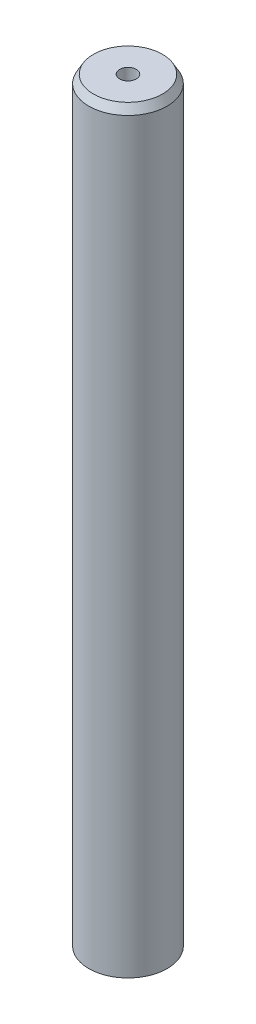
from build123d import *
from OCP.BRepFilletAPI import BRepFilletAPI_MakeChamfer

# Parameters (mm, degrees)
SKETCH1_R           = 5
BOSS_EXTRUDE1_DEPTH = 96.952888175
SKETCH2_R           = 1.064388396
CUT_EXTRUDE1_DEPTH  = 98.210403381
CHAMFER1_SIZE       = 1.035958614
CHAMFER1_SIZE2      = 0.598110985


with BuildPart() as part:
    # Sketch1 → Boss-Extrude1 (new body)
    with BuildSketch(Plane(origin=(0, 0, 0), x_dir=(1, 0, 0), z_dir=(0, 1, 0))):
        Circle(SKETCH1_R)
    extrude(amount=BOSS_EXTRUDE1_DEPTH)

    # Sketch2 → Cut-Extrude1 (cut, through all)
    with BuildSketch(Plane(origin=(0, 0, 0), x_dir=(1, 0, 0), z_dir=(0, 1, 0))):
        Circle(SKETCH2_R)
    extrude(amount=CUT_EXTRUDE1_DEPTH, mode=Mode.SUBTRACT)

    # Chamfer1: one chamfer whose edges measure the first distance from different faces: ONE call of the kernel's chamfer builder (chamfer() names one face for all edges)
    chamfer1_edges_1 = [part.edges().sort_by_distance(p)[0] for p in [
        (-5, 96.952888175, 0),
    ]]
    chamfer1_side_1 = [part.faces().sort_by_distance(p)[0] for p in [
        (-5, 48.476444088, 0),
    ]]
    chamfer1_edges_2 = [part.edges().sort_by_distance(p)[0] for p in [
        (-5, 0, 0),
    ]]
    chamfer1_side_2 = [part.faces().sort_by_distance(p)[0] for p in [
        (-4.858578644, 0, 0),
    ]]
    chamfer1 = BRepFilletAPI_MakeChamfer(part.part.solid().wrapped)
    for e in chamfer1_edges_1:
        chamfer1.Add(CHAMFER1_SIZE, CHAMFER1_SIZE2, e.wrapped, chamfer1_side_1[0].wrapped)  # the first distance lies on this face
    for e in chamfer1_edges_2:
        chamfer1.Add(CHAMFER1_SIZE, CHAMFER1_SIZE2, e.wrapped, chamfer1_side_2[0].wrapped)  # the first distance lies on this face
    add(Compound.cast(chamfer1.Shape()), mode=Mode.REPLACE)


solid = part.part
